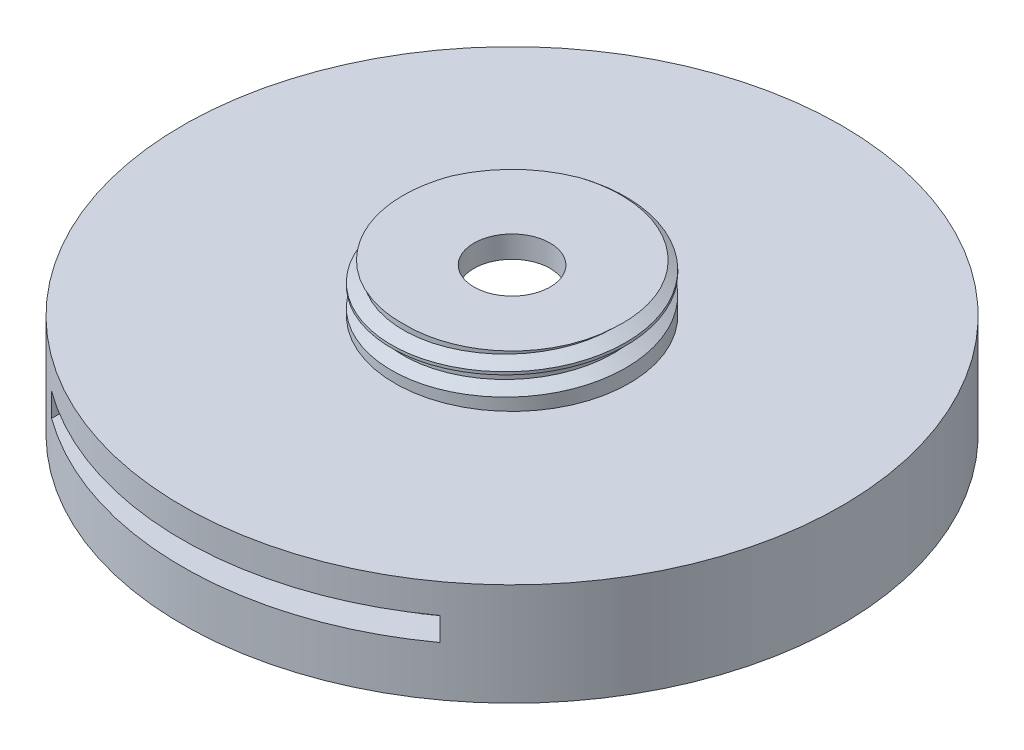
from build123d import *

# Parameters (mm, degrees)
SKIZZE1_R                            = 5
ZYLINDER_DEPTH                       = 2.2
SCHNITT_LINEAR_AUSTRAGEN1_DEPTH      = 10
SCHNITT_LINEAR_AUSTRAGEN1_DEPTH_BACK = 5
SKIZZE4_R                            = 4.5
SKIZZE6_R                            = 22.5
FASSUNG_OBJEKTTR_GERGEWINDE_DEPTH    = 7
SKIZZE11_R                           = 20.3
BOHRUNG_F_R_INNENGEWINDE_DEPTH       = 6
SKIZZE13_R                           = 8
ZYLINDER_F_R_GEWINDE_DEPTH           = 3
SKIZZE16_R                           = 2.6
LINSENEINSATZ_DEPTH                  = 10
GEWINDE1_PITCH                       = 1.5
SKIZZE17_W                           = 26.5
SKIZZE17_H                           = 49.541135346
SCHLITZ_F_R_SLIDE_DEPTH              = 1.6
SKIZZE21_R                           = 6.5
FILTEREINSATZ_DEPTH                  = 2.5


with BuildPart() as part:
    # Skizze1 → Zylinder (new body)
    with BuildSketch(Plane(origin=(0, 0, 0), x_dir=(1, 0, 0), z_dir=(0, 1, 0))):
        with Locations(Location((-18.043745097, 0, 0), (0, 0, 270))):
            Circle(SKIZZE1_R)
    extrude(amount=ZYLINDER_DEPTH)

    # Skizze4 → Schnitt-Linear austragen1 (cut, two sides: drawn at the far end of the back side and taken through both)
    with BuildSketch(Plane(origin=(0, 2.2, 0), x_dir=(1, 0, 0), z_dir=(0, 1, 0)).offset(-SCHNITT_LINEAR_AUSTRAGEN1_DEPTH_BACK)):
        with Locations(Location((-18.043745097, 0, 0), (0, 0, 270))):
            Circle(SKIZZE4_R)
    extrude(amount=SCHNITT_LINEAR_AUSTRAGEN1_DEPTH + SCHNITT_LINEAR_AUSTRAGEN1_DEPTH_BACK, mode=Mode.SUBTRACT)

    # Skizze6 → Fassung Objektträgergewinde (add)
    with BuildSketch(Plane(origin=(0, 0, 0), x_dir=(-1, 0, 0), z_dir=(0, -1, 0))):
        with Locations(Location((18.043745097, 0, 0), (0, 0, 90))):
            Circle(SKIZZE6_R)
    extrude(amount=FASSUNG_OBJEKTTR_GERGEWINDE_DEPTH)

    # Skizze11 → Bohrung für Innengewinde (cut)
    with BuildSketch(Plane(origin=(0, -7, 0), x_dir=(-1, 0, 0), z_dir=(0, -1, 0))):
        with Locations(Location((18.043745097, 0, 0), (0, 0, 90))):
            Circle(SKIZZE11_R)
    extrude(amount=-BOHRUNG_F_R_INNENGEWINDE_DEPTH, mode=Mode.SUBTRACT)

    # Skizze13 → Zylinder für Gewinde (add)
    with BuildSketch(Plane(origin=(0, 0, 0), x_dir=(-1, 0, 0), z_dir=(0, -1, 0))):
        with Locations(Location((18.043745097, 0, 0), (0, 0, 90))):
            Circle(SKIZZE13_R)
    extrude(amount=-ZYLINDER_F_R_GEWINDE_DEPTH)

    # Skizze16 → Linseneinsatz (cut)
    with BuildSketch(Plane(origin=(0, -7, 0), x_dir=(-1, 0, 0), z_dir=(0, -1, 0))):
        with Locations(Location((18.043745097, 0, 0), (0, 0, 90))):
            Circle(SKIZZE16_R)
    extrude(amount=-LINSENEINSATZ_DEPTH, mode=Mode.SUBTRACT)

    # Gewinde1: the profile of Gewindeprofil1 profile screwed along a right-hand helix of 2.333333 turns, 8 arcs to a turn; built about Z, then put on its axis
    gewinde1_z = Axis((0, 0, 0), (0, 0, 1))
    gewinde1_corners = [(8.0003, 0, -0.000173205), (8.0003, 0, 1.312673201), (7.188101187, 0, 0.843749998), (7.188101187, 0, 0.468749998)]
    with BuildLine(mode=Mode.PRIVATE) as gewinde1_profile:
        Line(gewinde1_corners[0], gewinde1_corners[1])
        Line(gewinde1_corners[1], gewinde1_corners[2])
        Line(gewinde1_corners[2], gewinde1_corners[3])
        Line(gewinde1_corners[3], gewinde1_corners[0])
    gewinde1_cap = Face(gewinde1_profile.wire())
    gewinde1_turn_angles = [0, 22.5, 45, 67.5, 90, 112.5, 135, 157.5, 180, 202.5, 225, 247.5, 270, 292.5, 315, 337.5, 360]
    gewinde1_turn_weights = [1, 0.9238795325112867, 1, 0.9238795325112867, 1, 0.9238795325112867, 1, 0.9238795325112867, 1, 0.9238795325112867, 1, 0.9238795325112867, 1, 0.9238795325112867, 1, 0.9238795325112867, 1]
    gewinde1_turn_rails = [Edge.make_bspline([Vector(p[0], p[1], 0).rotate(gewinde1_z, gewinde1_turn_angles[k]) / gewinde1_turn_weights[k] + Vector(0, 0, p[2] + GEWINDE1_PITCH * gewinde1_turn_angles[k] / 360) for k in range(17)], [0, 0, 0, 1, 1, 2, 2, 3, 3, 4, 4, 5, 5, 6, 6, 7, 7, 8, 8, 8], 2, gewinde1_turn_weights) for p in gewinde1_corners]
    gewinde1_turn_sides = [Face.make_surface_from_curves(gewinde1_turn_rails[p[0]], gewinde1_turn_rails[p[1]]) for p in [(0, 1), (1, 2), (2, 3), (3, 0)]]
    gewinde1_last_angles = [720, 742.5, 765, 787.5, 810, 825, 840]
    gewinde1_last_weights = [1, 0.9238795325112867, 1, 0.9238795325112867, 1, 0.9659258262890685, 1]
    gewinde1_last_rails = [Edge.make_bspline([Vector(p[0], p[1], 0).rotate(gewinde1_z, gewinde1_last_angles[k]) / gewinde1_last_weights[k] + Vector(0, 0, p[2] + GEWINDE1_PITCH * gewinde1_last_angles[k] / 360) for k in range(7)], [0, 0, 0, 1, 1, 2, 2, 3, 3, 3], 2, gewinde1_last_weights) for p in gewinde1_corners]
    gewinde1_last_sides = [Face.make_surface_from_curves(gewinde1_last_rails[p[0]], gewinde1_last_rails[p[1]]) for p in [(0, 1), (1, 2), (2, 3), (3, 0)]]
    gewinde1 = Plane(origin=(-18.043745097, 4.6, 0), x_dir=(-1, 0, 0), z_dir=(0, -1, 0)) * Solid(Shell([*[p.moved(Location((0, 0, GEWINDE1_PITCH * i))) for i in range(2) for p in gewinde1_turn_sides], *gewinde1_last_sides, gewinde1_cap, gewinde1_cap.rotate(gewinde1_z, 840).moved(Location((0, 0, GEWINDE1_PITCH * 840 / 360)))]))
    add(gewinde1, mode=Mode.SUBTRACT)

    # Skizze17 → Schlitz für Slide (cut)
    with BuildSketch(Plane(origin=(0, -2, 0), x_dir=(1, 0, 0), z_dir=(0, 1, 0))):
        with Locations((-18.043745097, 0)):
            Rectangle(SKIZZE17_W, SKIZZE17_H)
    extrude(amount=-SCHLITZ_F_R_SLIDE_DEPTH, mode=Mode.SUBTRACT)

    # Skizze21 → Filtereinsatz (cut)
    with BuildSketch(Plane(origin=(0, -1, 0), x_dir=(-1, 0, 0), z_dir=(0, -1, 0))):
        with Locations(Location((18.043745097, 0, 0), (0, 0, 90))):
            Circle(SKIZZE21_R)
    extrude(amount=-FILTEREINSATZ_DEPTH, mode=Mode.SUBTRACT)


solid = part.part
